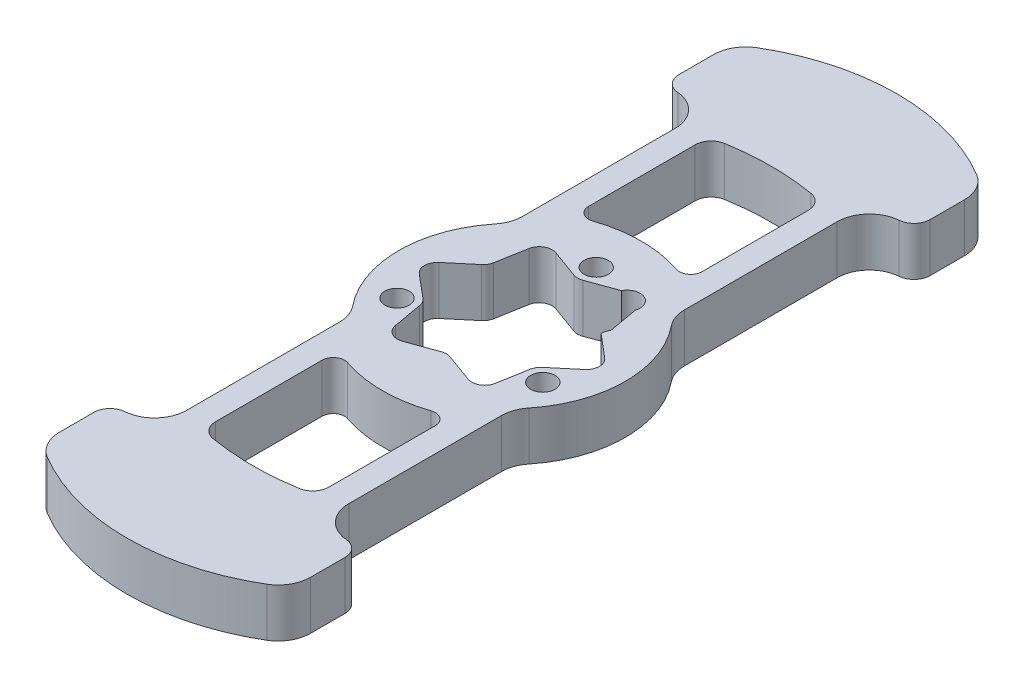
from build123d import *

# Parameters (mm, degrees)
SKETCH1_R           = 2.38125
BOSS_EXTRUDE1_DEPTH = 9.525


with BuildPart() as part:
    # Sketch1 → Boss-Extrude1 (new body)
    with BuildSketch(Plane(origin=(0, 0, 0), x_dir=(1, 0, 0), z_dir=(0, 1, 0))):
        with BuildLine():
            Line((-15.875, 47.889129042), (-15.875, 17.960512242))
            ThreePointArc((-15.875, 17.960512242), (-16.238162586, 15.843845575), (-17.286111111, 13.969287299))
            ThreePointArc((-17.286111111, 13.969287299), (-22.225, 0), (-17.286111111, -13.969287299))
            ThreePointArc((-17.286111111, -13.969287299), (-16.238162586, -15.843845575), (-15.875, -17.960512242))
            Line((-15.875, -17.960512242), (-15.875, -47.889129042))
            ThreePointArc((-15.875, -47.889129042), (-17.556159451, -52.193130427), (-21.709465489, -54.218167213))
            ThreePointArc((-21.709465489, -54.218167213), (-23.786118507, -55.230685605), (-24.626698233, -57.382686298))
            Line((-24.626698233, -57.382686298), (-24.626698233, -64.135527377))
            ThreePointArc((-24.626698233, -64.135527377), (-23.79330294, -67.280296447), (-21.511872248, -69.599605442))
            ThreePointArc((-21.511872248, -69.599605442), (3.185e-06, -75.490429062), (21.511877729, -69.599602197))
            ThreePointArc((21.511877729, -69.599602197), (23.793307834, -67.280293274), (24.626702889, -64.13552462))
            Line((24.626702889, -64.13552462), (24.626702889, -57.382687451))
            ThreePointArc((24.626702889, -57.382687451), (23.786121559, -55.230685018), (21.709465426, -54.218167981))
            ThreePointArc((21.709465426, -54.218167981), (17.556153159, -52.193133909), (15.874990499, -47.889129042))
            Line((15.874990499, -47.889129042), (15.874990499, -17.960523999))
            ThreePointArc((15.874990499, -17.960523999), (16.238153645, -15.843855749), (17.286103721, -13.969296444))
            ThreePointArc((17.286103721, -13.969296444), (22.225, 0), (17.286103721, 13.969296444))
            ThreePointArc((17.286103721, 13.969296444), (16.238153645, 15.843855749), (15.874990499, 17.960523999))
            Line((15.874990499, 17.960523999), (15.874990499, 47.889129042))
            ThreePointArc((15.874990499, 47.889129042), (17.556153159, 52.193133909), (21.709465426, 54.218167981))
            ThreePointArc((21.709465426, 54.218167981), (23.786121559, 55.230685018), (24.626702889, 57.382687451))
            Line((24.626702889, 57.382687451), (24.626702889, 64.13552462))
            ThreePointArc((24.626702889, 64.13552462), (23.793307834, 67.280293274), (21.511877729, 69.599602197))
            ThreePointArc((21.511877729, 69.599602197), (3.185e-06, 75.490429062), (-21.511872248, 69.599605442))
            ThreePointArc((-21.511872248, 69.599605442), (-23.79330294, 67.280296447), (-24.626698233, 64.135527377))
            Line((-24.626698233, 64.135527377), (-24.626698233, 57.382686298))
            ThreePointArc((-24.626698233, 57.382686298), (-23.786118507, 55.230685605), (-21.709465489, 54.218167213))
            ThreePointArc((-21.709465489, 54.218167213), (-17.556159451, 52.193130427), (-15.875, 47.889129042))
        make_face()
        with Locations((-14.298079416, -8.255)):
            Circle(SKETCH1_R, mode=Mode.SUBTRACT)
        with Locations((0, 16.51)):
            Circle(SKETCH1_R, mode=Mode.SUBTRACT)
        with Locations((14.298079416, -8.255)):
            Circle(SKETCH1_R, mode=Mode.SUBTRACT)
        with BuildLine():
            Line((6.435916019, 15.035929083), (0.879203083, 13.019133094))
            ThreePointArc((0.879203083, 13.019133094), (0.006721965, 12.862124307), (-0.866577957, 13.014512984))
            Line((-0.866577957, 13.014512984), (-6.435928113, 15.035895623))
            ThreePointArc((-6.435928113, 15.035895623), (-8.572498578, 14.847997044), (-9.803511258, 13.09162379))
            Line((-9.803511258, 13.09162379), (-10.83761762, 7.257733753))
            ThreePointArc((-10.83761762, 7.257733753), (-11.138925375, 6.431059337), (-11.704192542, 5.756781959))
            Line((-11.704192542, 5.756781959), (-16.239436336, 1.944274561))
            ThreePointArc((-16.239436336, 1.944274561), (-17.144998978, -2.816e-06), (-16.239436336, -1.944280194))
            Line((-16.239436336, -1.944280194), (-11.704192542, -5.756787592))
            ThreePointArc((-11.704192542, -5.756787592), (-11.138925375, -6.43106497), (-10.83761762, -7.257739386))
            Line((-10.83761762, -7.257739386), (-9.803511258, -13.091629423))
            ThreePointArc((-9.803511258, -13.091629423), (-8.572498978, -14.848008364), (-6.435924056, -15.035906801))
            Line((-6.435924056, -15.035906801), (-0.859723128, -13.01203769))
            ThreePointArc((-0.859723128, -13.01203769), (0.006721965, -12.862125742), (0.872361459, -13.016621555))
            Line((0.872361459, -13.016621555), (6.435925078, -15.035903984))
            ThreePointArc((6.435925078, -15.035903984), (8.5725, -14.848005548), (9.80351228, -13.091626607))
            Line((9.80351228, -13.091626607), (10.837618642, -7.257736569))
            ThreePointArc((10.837618642, -7.257736569), (11.138927312, -6.431063562), (11.704194586, -5.756787592))
            Line((11.704194586, -5.756787592), (16.239438381, -1.944280194))
            ThreePointArc((16.239438381, -1.944280194), (17.145001022, -2.816e-06), (16.239438381, 1.944274561))
            Line((16.239438381, 1.944274561), (11.704194586, 5.756781959))
            ThreePointArc((11.704194586, 5.756781959), (11.806935184, 6.542177335), (12.146606362, 7.257736569))
            Line((12.146606362, 7.257736569), (11.112490499, 13.091680206))
            ThreePointArc((11.112490499, 13.091680206), (9.673479342, 16.226867013), (6.435916019, 15.035929083))
        make_face(mode=Mode.SUBTRACT)
        with BuildLine():
            Line((-11.1125, 26.152827882), (-11.1125, 47.019076269))
            ThreePointArc((-11.1125, 47.019076269), (-10.362230703, 49.068785034), (-8.466008019, 50.149779748))
            ThreePointArc((-8.466008019, 50.149779748), (-5.138e-06, 50.859352145), (8.465997886, 50.149781459))
            ThreePointArc((8.465997886, 50.149781459), (10.362220995, 49.068786883), (11.112490499, 47.019077873))
            Line((11.112490499, 47.019077873), (11.112490499, 26.152831112))
            ThreePointArc((11.112490499, 26.152831112), (10.18416626, 24.346006453), (8.174703907, 24.048580333))
            ThreePointArc((8.174703907, 24.048580333), (-4.614e-06, 25.4), (-8.174712644, 24.048577363))
            ThreePointArc((-8.174712644, 24.048577363), (-10.184175433, 24.346002988), (-11.1125, 26.152827882))
        make_face(mode=Mode.SUBTRACT)
        with BuildLine():
            Line((11.112490499, -47.019077873), (11.112490499, -26.152831112))
            ThreePointArc((11.112490499, -26.152831112), (10.18416626, -24.346006453), (8.174703907, -24.048580333))
            ThreePointArc((8.174703907, -24.048580333), (-4.614e-06, -25.4), (-8.174712644, -24.048577363))
            ThreePointArc((-8.174712644, -24.048577363), (-10.184175433, -24.346002988), (-11.1125, -26.152827882))
            Line((-11.1125, -26.152827882), (-11.1125, -47.019076269))
            ThreePointArc((-11.1125, -47.019076269), (-10.362230703, -49.068785034), (-8.466008019, -50.149779748))
            ThreePointArc((-8.466008019, -50.149779748), (-5.138e-06, -50.859352145), (8.465997886, -50.149781459))
            ThreePointArc((8.465997886, -50.149781459), (10.362220995, -49.068786883), (11.112490499, -47.019077873))
        make_face(mode=Mode.SUBTRACT)
    extrude(amount=BOSS_EXTRUDE1_DEPTH)


solid = part.part
